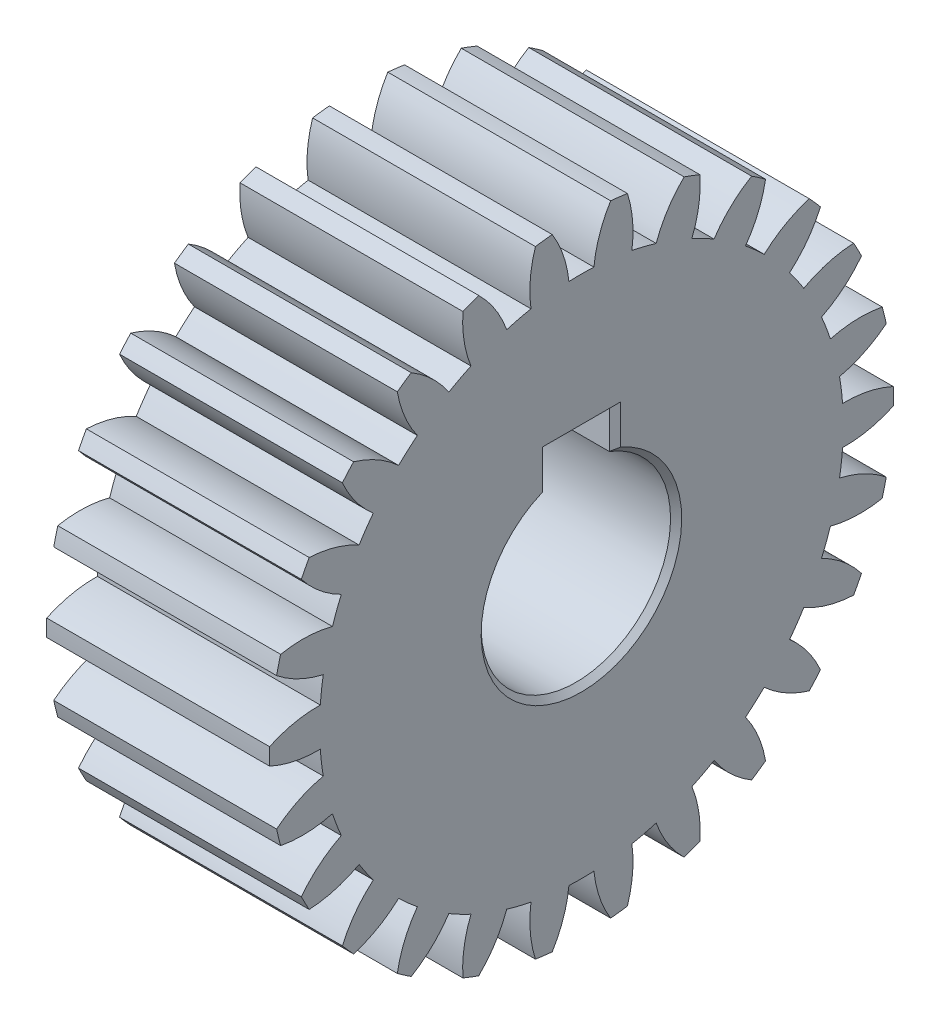
from build123d import *

# Parameters (mm, degrees)
BASPROSKE_W          = 20
BASPROSKE_H          = 28
TOOTHCUT_DEPTH       = 45.362146026
TEETHCUTS_COUNT      = 26
TEETHCUTS_ANGLE      = 346.153846154
BORSKE_R             = 8.5
BORE_DEPTH           = 50.0000508
KEYSKE_W             = 6
KEYSKE_H             = 11.3
KEYWAY_DEPTH         = 50.0000508
CHANFROS_0_5_45_SIZE = 0.5


with BuildPart() as part:
    # BasProSke → Base-Revolve (revolve)
    with BuildSketch(Plane(origin=(0, 0, 0), x_dir=(1, 0, 0), z_dir=(0, 1, 0))):
        with Locations((10, 14)):
            Rectangle(BASPROSKE_W, BASPROSKE_H)
    revolve(axis=Axis((-10, 0, 0), (1, 0, 0)))

    # TooCutSke → ToothCut (cut, through all)
    with BuildSketch(Plane(origin=(0, 0, 0), x_dir=(0, 0, -1), z_dir=(1, 0, 0))):
        with BuildLine():
            ThreePointArc((1.121687319, 23.472213755), (0, 23.499), (-1.121687319, 23.472213755))
            ThreePointArc((-1.121687319, 23.472213755), (-1.626477312, 25.772985276), (-2.63606961, 27.901150194))
            ThreePointArc((-2.63606961, 27.901150194), (0, 28.0254), (2.63606961, 27.901150194))
            ThreePointArc((2.63606961, 27.901150194), (1.626477312, 25.772985276), (1.121687319, 23.472213755))
        make_face()
    toothcut = extrude(amount=TOOTHCUT_DEPTH, mode=Mode.SUBTRACT)

    # TeethCuts: ToothCut ×26 about axis
    teethcuts_axis = Axis((-10, 0, 0), (1, 0, 0))
    for i in range(1, TEETHCUTS_COUNT):
        add(toothcut.rotate(teethcuts_axis, i * TEETHCUTS_ANGLE / (TEETHCUTS_COUNT - 1)), mode=Mode.SUBTRACT)

    # BorSke → Bore (cut, symmetric)
    with BuildSketch(Plane(origin=(0, 0, 0), x_dir=(0, 0, -1), z_dir=(1, 0, 0))):
        Circle(BORSKE_R)
    extrude(amount=BORE_DEPTH, both=True, mode=Mode.SUBTRACT)

    # KeySke → Keyway (cut, symmetric)
    with BuildSketch(Plane(origin=(0, 0, 0), x_dir=(0, 0, -1), z_dir=(1, 0, 0))):
        with Locations((0, 5.65)):
            Rectangle(KEYSKE_W, KEYSKE_H)
    extrude(amount=KEYWAY_DEPTH, both=True, mode=Mode.SUBTRACT)

    # Chanfros 0.5×45°
    chanfros_0_5_45_edges = [part.edges().sort_by_distance(p)[0] for p in [
        (0, -8.5, 0),
        (0, 9.62649343, 3),
        (0, 11.3, 0),
        (0, 9.62649343, -3),
        (20, 9.62649343, -3),
        (20, 11.3, 0),
        (20, 9.62649343, 3),
        (20, -8.5, 0),
    ]]
    chamfer(chanfros_0_5_45_edges, length=CHANFROS_0_5_45_SIZE)


solid = part.part
